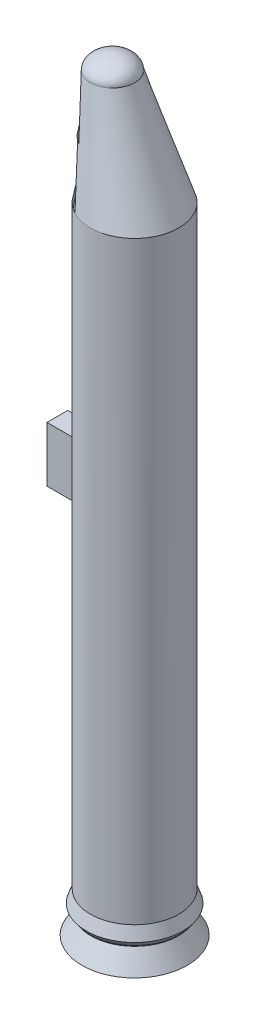
from build123d import *

# Parameters (mm, degrees)
FILLET1_R                            = 50
SKETCH10_W                           = 750
SKETCH10_H                           = 2000
BOSS_EXTRUDE1_DEPTH                  = 1200
BOSS_EXTRUDE1_DIRECTION_2_REACH      = 26740.623
BOSS_EXTRUDE1_DIRECTION_2_END_RADIUS = 1600
SKETCH11_R                           = 1475
BOSS_EXTRUDE2_DEPTH                  = 750
BOSS_EXTRUDE2_DRAFT                  = -30
SKETCH12_R                           = 1750
CUT_EXTRUDE1_DEPTH                   = 750
CUT_EXTRUDE1_DRAFT                   = -30
SKETCH13_R                           = 1250
CUT_EXTRUDE2_DEPTH                   = 22650


with BuildPart() as part:
    # Sketch2 → Revolve1 (revolve)
    with BuildSketch(Plane.XY, mode=Mode.PRIVATE) as revolve1_sk:
        Polygon((1600, 700), (1750.791507878, 250), (1600, 50), (1600, 0), (0, 0), (0, 22220), (1600, 22220), align=None)
    revolve(revolve1_sk.sketch.rotate(Axis((0, -2705.878414097, 0), (0, 1, 0)), 90), axis=Axis((0, -2705.878414097, 0), (0, 1, 0)))

    # Fillet1
    fillet1_edges = [part.edges().sort_by_distance(p)[0] for p in [
        (0, 0, 1600),
    ]]
    fillet(fillet1_edges, radius=FILLET1_R - 0.0001)  # a hair under: the kernel refuses the full size

    # Boundary1: read off the stored shape, not the designer's step
    # Boundary1: loft between two sections, ruled curve by curve
    boundary1_from = [
        Edge.make_bspline([(-1323.003919074, 25970, 606.769768475), (-1342.860413314, 25970, 589.70785677), (-1380.897126833, 25970, 553.633200143), (-1432.373248142, 25970, 494.189156203), (-1477.775079139, 25970, 429.985920218), (-1516.665272091, 25970, 361.64161729), (-1548.66923545, 25970, 289.814537894), (-1573.478835525, 25970, 215.196384006), (-1590.855105019, 25970, 138.505774662), (-1600.630712729, 25970, 60.481275823), (-1602.711508541, 25970, -18.12569002), (-1597.077455882, 25970, -96.558097054), (-1583.782812036, 25970, -174.060597062), (-1562.95561236, 25970, -249.88679919), (-1534.7964336, 25970, -323.306455184), (-1499.576464205, 25970, -393.612493695), (-1457.634891579, 25970, -460.127828885), (-1409.375636075, 25970, -522.211881666), (-1355.263460742, 25970, -579.266748486), (-1295.819495505, 25970, -630.742959815), (-1231.6162184, 25970, -676.144771387), (-1163.27194215, 25970, -715.034939253), (-1091.444859775, 25970, -747.038929331), (-1016.82670521, 25970, -771.848526843), (-940.136092662, 25970, -789.224800035), (-862.111593824, 25970, -799.000409612), (-783.504628952, 25970, -801.081204804), (-705.072222946, 25970, -795.447158848), (-627.569728993, 25970, -782.152506388), (-551.743522229, 25970, -761.325343912), (-478.32386021, 25970, -733.16612145), (-408.017811703, 25970, -697.946171801), (-341.502475056, 25970, -656.004586009), (-279.418419748, 25970, -607.745334848), (-222.36355682, 25970, -553.633156345), (-170.887332284, 25970, -494.189191675), (-125.485538682, 25970, -429.985901669), (-86.595326786, 25970, -361.641626127), (-54.591372639, 25970, -289.814533412), (-29.781767795, 25970, -215.19638642), (-12.405500881, 25970, -138.505773345), (-2.629891763, 25970, -60.481276542), (-0.549096718, 25970, 18.125690411), (-6.18314896, 25970, 96.558096841), (-19.477793033, 25970, 174.060597178), (-40.304992586, 25970, 249.886799127), (-68.464171413, 25970, 323.306455219), (-103.68414077, 25970, 393.612493676), (-145.625713419, 25970, 460.127828897), (-193.884968906, 25970, 522.211881656), (-247.997144258, 25970, 579.266748497), (-307.441109467, 25970, 630.742959798), (-371.644386619, 25970, 676.144771416), (-439.988662784, 25970, 715.034939201), (-511.815745316, 25970, 747.038929427), (-586.43389959, 25970, 771.848526665), (-663.124512673, 25970, 789.224800362), (-741.149010529, 25970, 799.000409012), (-819.755977202, 25970, 801.081205903), (-898.188379908, 25970, 795.447156835), (-975.69087996, 25970, 782.152510127), (-1051.517074943, 25970, 761.32533654), (-1124.936761185, 25970, 733.166136928), (-1195.242761915, 25970, 697.946142179), (-1261.758161392, 25970, 656.00467037), (-1303.147424834, 25970, 623.831680179), (-1323.003919074, 25970, 606.769768475)], [0, 0, 0, 0, 0.015625, 0.03125, 0.046875, 0.0625, 0.078125, 0.09375, 0.109375, 0.125, 0.140625, 0.15625, 0.171875, 0.1875, 0.203125, 0.21875, 0.234375, 0.25, 0.265625, 0.28125, 0.296875, 0.3125, 0.328125, 0.34375, 0.359375, 0.375, 0.390625, 0.40625, 0.421875, 0.4375, 0.453125, 0.46875, 0.484375, 0.5, 0.515625, 0.53125, 0.546875, 0.5625, 0.578125, 0.59375, 0.609375, 0.625, 0.640625, 0.65625, 0.671875, 0.6875, 0.703125, 0.71875, 0.734375, 0.75, 0.765625, 0.78125, 0.796875, 0.8125, 0.828125, 0.84375, 0.859375, 0.875, 0.890625, 0.90625, 0.921875, 0.9375, 0.953125, 0.96875, 0.984375, 1, 1, 1, 1], 3),
    ]
    boundary1_to = [
        Edge.make_bspline([(-667.923185242, 22220, 1453.918367246), (-715.502552549, 22220, 1432.060632122), (-808.513842465, 22220, 1383.670658341), (-940.243888947, 22220, 1297.759499286), (-1062.919079799, 22220, 1199.350545238), (-1175.357713972, 22220, 1089.390989836), (-1276.477048702, 22220, 968.940112529), (-1365.303193281, 22220, 839.157750654), (-1440.980732574, 22220, 701.293873167), (-1502.78083615, 22220, 556.676131724), (-1550.10833796, 22220, 406.697304825), (-1582.50745456, 22220, 252.801750406), (-1599.66614457, 22220, 96.471584468), (-1601.419201143, 22220, -60.7876697), (-1587.749662493, 22220, -217.461483935), (-1558.789313338, 22220, -372.041066137), (-1514.816872828, 22220, -523.037624825), (-1456.255987266, 22220, -668.997076779), (-1383.670520031, 22220, -808.51370253), (-1297.75961843, 22220, -940.243931679), (-1199.350469391, 22220, -1062.919065238), (-1089.391007001, 22220, -1175.357746657), (-968.940063421, 22220, -1276.477063538), (-839.157724165, 22220, -1365.303220444), (-701.293823567, 22220, -1440.980752104), (-556.676088445, 22220, -1502.78085376), (-406.697255474, 22220, -1550.108351335), (-252.801709217, 22220, -1582.507458205), (-96.471544574, 22220, -1599.666152858), (60.787691187, 22220, -1601.419187602), (217.461507755, 22220, -1587.749682305), (372.041048221, 22220, -1558.789277894), (523.037631451, 22220, -1514.816887316), (668.997071089, 22220, -1456.255974911), (808.513709233, 22220, -1383.670534483), (940.243916416, 22220, -1297.759581772), (1062.919064842, 22220, -1199.350500316), (1175.357722211, 22220, -1089.391014585), (1276.477044162, 22220, -968.940098892), (1365.303195776, 22220, -839.157758149), (1440.980731206, 22220, -701.293869059), (1502.780836897, 22220, -556.676133969), (1550.108337552, 22220, -406.697303602), (1582.507454781, 22220, -252.801751071), (1599.666144451, 22220, -96.471584108), (1601.419201208, 22220, 60.787669508), (1587.749662459, 22220, 217.461484035), (1558.789313355, 22220, 372.04106609), (1514.816872817, 22220, 523.037624854), (1456.255987277, 22220, 668.997076756), (1383.670520017, 22220, 808.513702557), (1297.759618455, 22220, 940.243931635), (1199.350469338, 22220, 1062.919065329), (1089.391007105, 22220, 1175.357746483), (968.940063227, 22220, 1276.477063863), (839.157724525, 22220, 1365.303219844), (701.293822904, 22220, 1440.98075321), (556.676089662, 22220, 1502.780851731), (406.697253248, 22220, 1550.108355048), (252.801713278, 22220, 1582.507451429), (96.471537186, 22220, 1599.666165186), (-60.787677778, 22220, 1601.419165228), (-217.461532093, 22220, 1587.749722917), (-372.041003536, 22220, 1558.789203317), (-523.037638623, 22220, 1514.817069086), (-620.343817935, 22220, 1475.77610237), (-667.923185242, 22220, 1453.918367246)], [0, 0, 0, 0, 0.015625, 0.03125, 0.046875, 0.0625, 0.078125, 0.09375, 0.109375, 0.125, 0.140625, 0.15625, 0.171875, 0.1875, 0.203125, 0.21875, 0.234375, 0.25, 0.265625, 0.28125, 0.296875, 0.3125, 0.328125, 0.34375, 0.359375, 0.375, 0.390625, 0.40625, 0.421875, 0.4375, 0.453125, 0.46875, 0.484375, 0.5, 0.515625, 0.53125, 0.546875, 0.5625, 0.578125, 0.59375, 0.609375, 0.625, 0.640625, 0.65625, 0.671875, 0.6875, 0.703125, 0.71875, 0.734375, 0.75, 0.765625, 0.78125, 0.796875, 0.8125, 0.828125, 0.84375, 0.859375, 0.875, 0.890625, 0.90625, 0.921875, 0.9375, 0.953125, 0.96875, 0.984375, 1, 1, 1, 1], 3),
    ]
    boundary1 = Solid(Shell([*[Face.make_surface_from_curves(boundary1_from[k], boundary1_to[k]) for k in range(1)], Face(Wire(boundary1_from)), Face(Wire(boundary1_to))]))
    add(boundary1)

    # Dome1: read off the stored shape, not the designer's step
    # Dome1 outline → Dome1 (revolve)
    with BuildSketch(Plane(origin=(-801.630302494, 0, 0), x_dir=(1, 0, 0), z_dir=(0, 0, 1))):
        with BuildLine():
            add(Edge.make_bspline(
                [(0, 26470), (800, 26470), (800, 25970)],
                knots=[4.71238898, 4.71238898, 4.71238898, 6.283185307, 6.283185307, 6.283185307], degree=2, weights=[1, 0.707106781, 1]))
            Line((0, 26470), (0, 25970))
            Line((0, 25970), (800, 25970))
        make_face()
    revolve(axis=Axis((-801.630302494, 0, 0), (0, 1, 0)))

    # Sketch10 → Boss-Extrude1 (add)
    with BuildSketch(Plane(origin=(-1600, 0, 0), x_dir=(0, 0, -1), z_dir=(1, 0, 0))):
        with Locations((0, 13110)):
            Rectangle(SKETCH10_W, SKETCH10_H)
    extrude(amount=-BOSS_EXTRUDE1_DEPTH)

    # Boss-Extrude1 direction 2: up to this cylinder (the profile starts outside it)
    boss_extrude1_direction_2_end = Plane(origin=(0, 13110, 0), z_dir=(0, -1, 0)) * Cylinder(BOSS_EXTRUDE1_DIRECTION_2_END_RADIUS, 56682.246, mode=Mode.PRIVATE)
    # Sketch10 → Boss-Extrude1 direction 2 (add, up to the surface)
    with BuildSketch(Plane(origin=(-1600, 0, 0), x_dir=(0, 0, -1), z_dir=(1, 0, 0)), mode=Mode.PRIVATE) as boss_extrude1_direction_2_sk1:
        with Locations((0, 13110)):
            Rectangle(SKETCH10_W, SKETCH10_H)
    boss_extrude1_direction_2_tool1 = extrude(boss_extrude1_direction_2_sk1.sketch, amount=BOSS_EXTRUDE1_DIRECTION_2_REACH, mode=Mode.PRIVATE) - boss_extrude1_direction_2_end
    add(boss_extrude1_direction_2_tool1.solids().sort_by_distance((-1600, 13110, 0))[0])
    add(boss_extrude1_direction_2_tool1.solids().sort_by_distance((-1600, 13110, 0))[1])


with BuildPart() as boss_extrude2_tool:
    # Sketch11 → Boss-Extrude2 (with draft: the straight prism first)
    with BuildSketch(Plane.XZ):
        Circle(SKETCH11_R)
    extrude(amount=BOSS_EXTRUDE2_DEPTH)
    # Boss-Extrude2: the draft: its side faces are tilted about the plane it starts from
    boss_extrude2_sides = [boss_extrude2_tool.faces().sort_by_distance(p)[0] for p in [
        (-1475, -375, 0),
    ]]
    draft(boss_extrude2_sides, Plane.XZ, BOSS_EXTRUDE2_DRAFT)


with BuildPart() as part_1:
    add(part.part)

    # Boss-Extrude2: add boss_extrude2_tool
    add(boss_extrude2_tool.part)


with BuildPart() as cut_extrude1_tool:
    # Sketch12 → Cut-Extrude1 (with draft: the straight prism first)
    with BuildSketch(Plane.XZ.offset(750)):
        Circle(SKETCH12_R)
    extrude(amount=-CUT_EXTRUDE1_DEPTH)
    # Cut-Extrude1: the draft: its side faces are tilted about the plane it starts from
    cut_extrude1_sides = [cut_extrude1_tool.faces().sort_by_distance(p)[0] for p in [
        (-1750, -375, 0),
    ]]
    draft(cut_extrude1_sides, Plane.XZ.offset(750), CUT_EXTRUDE1_DRAFT)


with BuildPart() as part_2:
    add(part_1.part)

    # Cut-Extrude1: cut by cut_extrude1_tool
    add(cut_extrude1_tool.part, mode=Mode.SUBTRACT)

    # Sketch13 → Cut-Extrude2 (cut)
    with BuildSketch(Plane.XZ):
        with Locations(Location((0, 0, 0), (0, 0, 270))):
            Circle(SKETCH13_R)
    extrude(amount=-CUT_EXTRUDE2_DEPTH, mode=Mode.SUBTRACT)


solid = part_2.part
